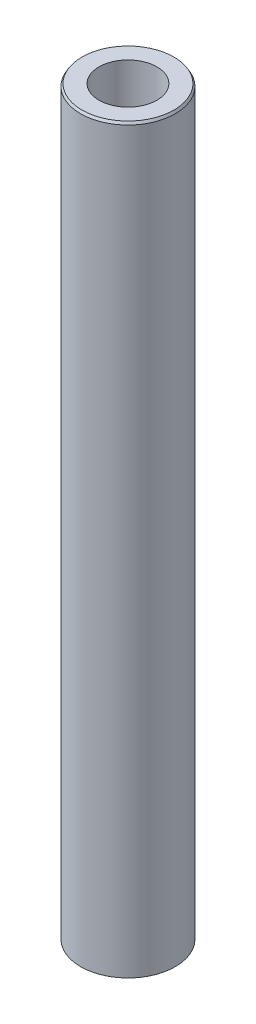
from build123d import *
from OCP.BRepFilletAPI import BRepFilletAPI_MakeChamfer

# Parameters (mm, degrees)
SKETCH1_R           = 22.5
BOSS_EXTRUDE1_DEPTH = 352.529486001
SKETCH2_R           = 13.746641871
CUT_EXTRUDE1_DEPTH  = 354.962623027
CHAMFER1_SIZE       = 1.171673224
CHAMFER1_SIZE2      = 0.676465851


with BuildPart() as part:
    # Sketch1 → Boss-Extrude1 (new body)
    with BuildSketch(Plane(origin=(0, 0, 0), x_dir=(1, 0, 0), z_dir=(0, 1, 0))):
        Circle(SKETCH1_R)
    extrude(amount=BOSS_EXTRUDE1_DEPTH)

    # Sketch2 → Cut-Extrude1 (cut, through all)
    with BuildSketch(Plane(origin=(0, 0, 0), x_dir=(1, 0, 0), z_dir=(0, 1, 0))):
        Circle(SKETCH2_R)
    extrude(amount=CUT_EXTRUDE1_DEPTH, mode=Mode.SUBTRACT)

    # Chamfer1: one chamfer whose edges measure the first distance from different faces: ONE call of the kernel's chamfer builder (chamfer() names one face for all edges)
    chamfer1_edges_1 = [part.edges().sort_by_distance(p)[0] for p in [
        (-22.5, 352.529486001, 0),
    ]]
    chamfer1_side_1 = [part.faces().sort_by_distance(p)[0] for p in [
        (-22.5, 176.264743, 0),
    ]]
    chamfer1_edges_2 = [part.edges().sort_by_distance(p)[0] for p in [
        (-22.5, 0, 0),
    ]]
    chamfer1_side_2 = [part.faces().sort_by_distance(p)[0] for p in [
        (-21.863603897, 0, 0),
    ]]
    chamfer1 = BRepFilletAPI_MakeChamfer(part.part.solid().wrapped)
    for e in chamfer1_edges_1:
        chamfer1.Add(CHAMFER1_SIZE, CHAMFER1_SIZE2, e.wrapped, chamfer1_side_1[0].wrapped)  # the first distance lies on this face
    for e in chamfer1_edges_2:
        chamfer1.Add(CHAMFER1_SIZE, CHAMFER1_SIZE2, e.wrapped, chamfer1_side_2[0].wrapped)  # the first distance lies on this face
    add(Compound.cast(chamfer1.Shape()), mode=Mode.REPLACE)


solid = part.part
